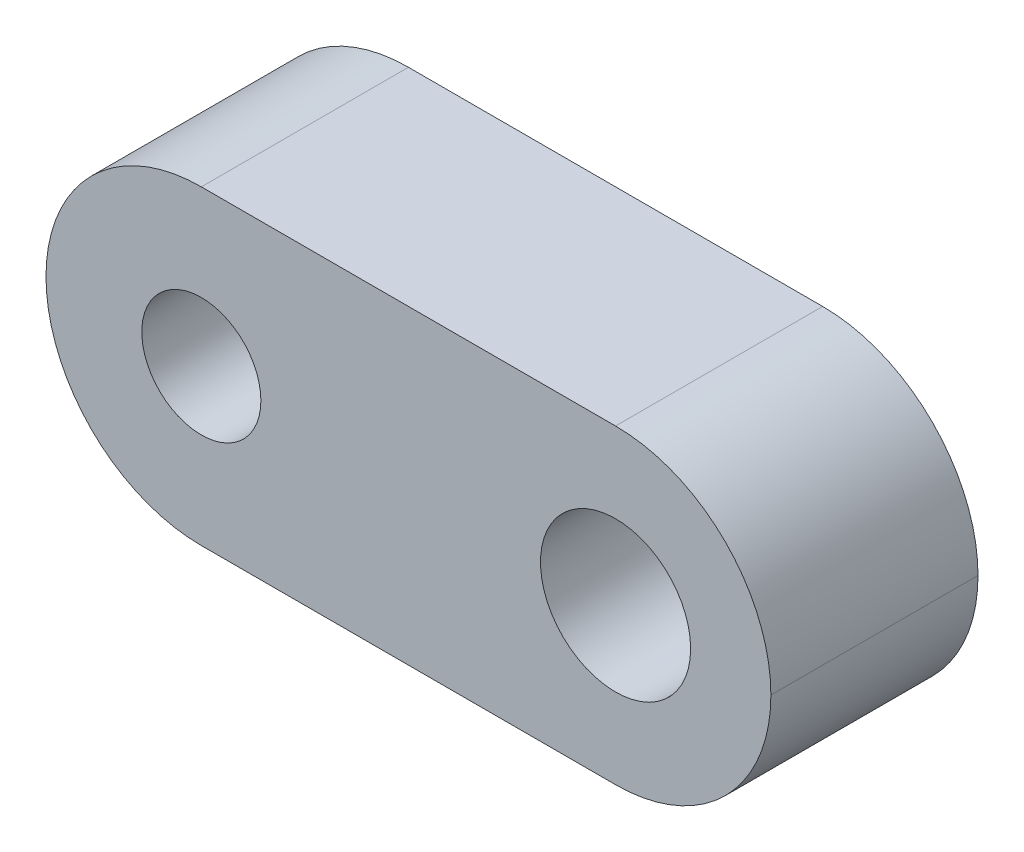
from build123d import *

# Parameters (mm, degrees)
SKETCH1_W               = 14
SKETCH1_H               = 6
BOSS_EXTRUDE1_DEPTH     = 4
CUT_EXTRUDE1_DEPTH      = 16.748015748
CUT_EXTRUDE1_DEPTH_BACK = 16.748015748
SKETCH2_R               = 1.15
SKETCH2_R_2             = 1.45
FILLET1_R               = 3


with BuildPart() as part:
    # Sketch1 → Boss-Extrude1 (new body)
    with BuildSketch(Plane.XY):
        with Locations((7, -3)):
            Rectangle(SKETCH1_W, SKETCH1_H)
    extrude(amount=BOSS_EXTRUDE1_DEPTH)

    # Sketch2 → Cut-Extrude1 (cut, two sides: drawn at the far end of the back side and taken through both)
    with BuildSketch(Plane.XY.offset(4).offset(-CUT_EXTRUDE1_DEPTH_BACK)):
        with Locations((3, -3)):
            Circle(SKETCH2_R)
        with Locations((11, -3)):
            Circle(SKETCH2_R_2)
    extrude(amount=CUT_EXTRUDE1_DEPTH + CUT_EXTRUDE1_DEPTH_BACK, mode=Mode.SUBTRACT)

    # Fillet1
    fillet1_edges = [part.edges().sort_by_distance(p)[0] for p in [
        (14, -6, 2),
        (14, 0, 2),
        (0, -6, 2),
        (0, 0, 2),
    ]]
    fillet(fillet1_edges, radius=FILLET1_R - 0.0001)  # a hair under: the kernel refuses the full size


solid = part.part
